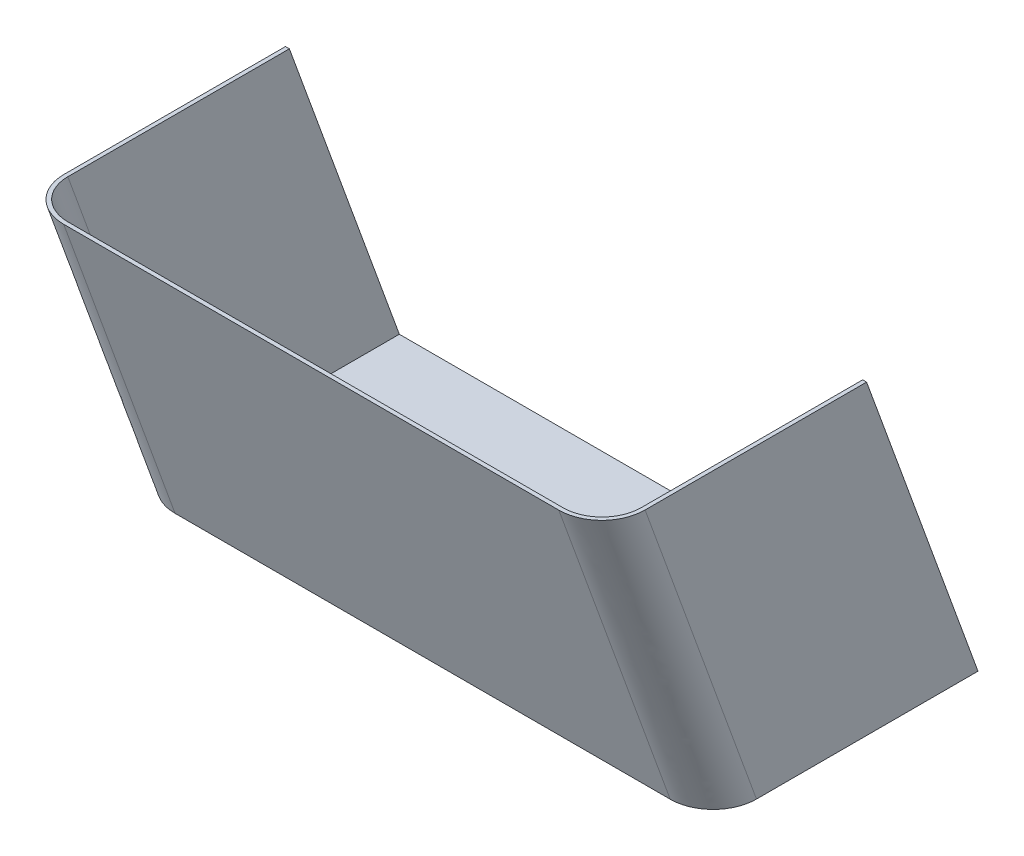
from build123d import *

# Parameters (mm, degrees)
SWEEP_THIN1_START       = 35.293924935
SWEEP_THIN1_DEPTH       = 179.41214993
SWEEP_THIN1_START_2     = -35.293925135
SWEEP_THIN1_2_DEPTH     = 320.587850271
SWEEP_THIN1_START_3     = -67
SWEEP_THIN1_3_OUTLINE_W = 446
SWEEP_THIN1_3_OUTLINE_H = 295
SWEEP_THIN1_3_DEPTH     = 67
SWEEP_THIN1_START_4     = 234.923155196
SWEEP_THIN1_4_OUTLINE_W = 446
SWEEP_THIN1_4_OUTLINE_H = 295
SWEEP_THIN1_4_DEPTH     = 66.330881924
BOSS_EXTRUDE2_DEPTH     = 3
SKETCH6_W               = 723.00386444
SKETCH6_H               = 605.053805232
CUT_EXTRUDE1_DEPTH      = 3


with BuildPart() as part:
    # Sweep-Thin1: read off the stored shape, not the designer's step
    # Sweep-Thin1 outline → Sweep-Thin1 (new body)
    with BuildSketch(Plane(origin=(0, 0, 0), x_dir=(1, 0, 0), z_dir=(0, 0.9396926207859089, 0.3420201433256672)).offset(SWEEP_THIN1_START)):
        with BuildLine():
            Line((223, -65.778483455), (223, 96.969262079))
            Line((223, 96.969262079), (-223, 96.969262079))
            Line((-223, 96.969262079), (-223, -65.778483455))
            add(Edge.make_bspline(
                [(-223, -65.778483455), (-223, -69.477042237), (-222.493972968, -73.37256542), (-221.393047263, -77.378729206), (-219.625765413, -81.371277703), (-217.160966169, -85.187590547), (-214.030117008, -88.644891061), (-210.35485162, -91.564481232), (-206.328004584, -93.851338413), (-202.135894004, -95.485342048), (-197.941508955, -96.501990369), (-193.867765418, -96.969262079), (-190, -96.969262079)],
                knots=[0, 0, 0, 0, 0, 0, 0, 0, 0, 0, 0, 0, 0, 1, 1, 1, 1, 1, 1, 1, 1, 1, 1, 1, 1, 1], degree=12))
            Line((-190, -96.969262079), (190, -96.969262079))
            add(Edge.make_bspline(
                [(190, -96.969262079), (193.867765418, -96.969262079), (197.941508955, -96.501990369), (202.135894005, -95.485342048), (206.328004584, -93.851338413), (210.35485162, -91.564481232), (214.030117008, -88.644891061), (217.16096617, -85.187590547), (219.625765413, -81.371277703), (221.393047263, -77.378729206), (222.493972968, -73.37256542), (223, -69.477042237), (223, -65.778483455)],
                knots=[0, 0, 0, 0, 0, 0, 0, 0, 0, 0, 0, 0, 0, 1, 1, 1, 1, 1, 1, 1, 1, 1, 1, 1, 1, 1], degree=12))
        make_face()
        with BuildLine():
            Line((-220, 93.969262079), (220, 93.969262079))
            Line((220, 93.969262079), (220, -65.778483455))
            add(Edge.make_bspline(
                [(190, -93.969262079), (207.573593129, -93.969262079), (220, -82.292259239), (220, -65.778483455)],
                knots=[0, 0, 0, 0, 1, 1, 1, 1], degree=3, weights=[1, 0.804737854, 0.804737854, 1]))
            Line((190, -93.969262079), (-190, -93.969262079))
            add(Edge.make_bspline(
                [(-220, -65.778483455), (-220, -82.292259239), (-207.573593129, -93.969262079), (-190, -93.969262079)],
                knots=[0, 0, 0, 0, 1, 1, 1, 1], degree=3, weights=[1, 0.804737854, 0.804737854, 1]))
            Line((-220, -65.778483455), (-220, 93.969262079))
        make_face(mode=Mode.SUBTRACT)
    extrude(amount=SWEEP_THIN1_DEPTH)

    # Sweep-Thin1 2 outline → Sweep-Thin1 2 (add)
    with BuildSketch(Plane(origin=(0, 0, 0), x_dir=(1, 0, 0), z_dir=(0, 0.9396926207859089, 0.3420201433256672)).offset(SWEEP_THIN1_START_2)):
        with BuildLine():
            Line((-223, 96.969262079), (-223, -65.778483455))
            add(Edge.make_bspline(
                [(-223, -65.778483455), (-223, -69.477042237), (-222.493972968, -73.37256542), (-221.393047263, -77.378729206), (-219.625765413, -81.371277703), (-217.160966169, -85.187590547), (-214.030117008, -88.644891061), (-210.35485162, -91.564481232), (-206.328004584, -93.851338413), (-202.135894004, -95.485342048), (-197.941508955, -96.501990369), (-193.867765418, -96.969262079), (-190, -96.969262079)],
                knots=[0, 0, 0, 0, 0, 0, 0, 0, 0, 0, 0, 0, 0, 1, 1, 1, 1, 1, 1, 1, 1, 1, 1, 1, 1, 1], degree=12))
            Line((-190, -96.969262079), (190, -96.969262079))
            add(Edge.make_bspline(
                [(190, -96.969262079), (193.867765418, -96.969262079), (197.941508955, -96.501990369), (202.135894005, -95.485342048), (206.328004584, -93.851338413), (210.35485162, -91.564481232), (214.030117008, -88.644891061), (217.16096617, -85.187590547), (219.625765413, -81.371277703), (221.393047263, -77.378729206), (222.493972968, -73.37256542), (223, -69.477042237), (223, -65.778483455)],
                knots=[0, 0, 0, 0, 0, 0, 0, 0, 0, 0, 0, 0, 0, 1, 1, 1, 1, 1, 1, 1, 1, 1, 1, 1, 1, 1], degree=12))
            Line((223, -65.778483455), (223, 96.969262079))
            Line((223, 96.969262079), (-223, 96.969262079))
        make_face()
        with BuildLine():
            add(Edge.make_bspline(
                [(-220, -65.778483455), (-220, -82.292259239), (-207.573593129, -93.969262079), (-190, -93.969262079)],
                knots=[0, 0, 0, 0, 1, 1, 1, 1], degree=3, weights=[1, 0.804737854, 0.804737854, 1]))
            Line((-220, -65.778483455), (-220, 93.969262079))
            Line((-220, 93.969262079), (220, 93.969262079))
            Line((220, 93.969262079), (220, -65.778483455))
            add(Edge.make_bspline(
                [(190, -93.969262079), (207.573593129, -93.969262079), (220, -82.292259239), (220, -65.778483455)],
                knots=[0, 0, 0, 0, 1, 1, 1, 1], degree=3, weights=[1, 0.804737854, 0.804737854, 1]))
            Line((190, -93.969262079), (-190, -93.969262079))
        make_face(mode=Mode.SUBTRACT)
    extrude(amount=SWEEP_THIN1_2_DEPTH)

    # Sweep-Thin1 3 outline → Sweep-Thin1 3 (cut)
    with BuildSketch(Plane(origin=(0, 0, 0), x_dir=(1, 0, 0), z_dir=(0, 1, 0)).offset(SWEEP_THIN1_START_3)):
        with Locations((0, -42.5)):
            Rectangle(SWEEP_THIN1_3_OUTLINE_W, SWEEP_THIN1_3_OUTLINE_H)
    extrude(amount=SWEEP_THIN1_3_DEPTH, mode=Mode.SUBTRACT)

    # Sweep-Thin1 4 outline → Sweep-Thin1 4 (cut)
    with BuildSketch(Plane(origin=(0, 0, 0), x_dir=(1, 0, 0), z_dir=(0, 1, 0)).offset(SWEEP_THIN1_START_4)):
        with Locations((0, -42.5)):
            Rectangle(SWEEP_THIN1_4_OUTLINE_W, SWEEP_THIN1_4_OUTLINE_H)
    extrude(amount=SWEEP_THIN1_4_DEPTH, mode=Mode.SUBTRACT)


with BuildPart() as body_2:
    # Sketch5 → Boss-Extrude2 (new body)
    with BuildSketch(Plane(origin=(0, 0, 0), x_dir=(1, 0, 0), z_dir=(0, 1, 0))):
        with BuildLine():
            Line((-190, -100), (190, -100))
            ThreePointArc((190, -100), (211.213203436, -91.213203436), (220, -70))
            Line((220, -70), (220, 100))
            Line((220, 100), (-220, 100))
            Line((-220, 100), (-220, -70))
            ThreePointArc((-220, -70), (-211.213203436, -91.213203436), (-190, -100))
        make_face()
    extrude(amount=BOSS_EXTRUDE2_DEPTH)


with BuildPart() as cut_extrude1_tool:
    # Sketch6 → Cut-Extrude1 (new body)
    with BuildSketch(Plane(origin=(0, 33.165440914, -91.121300018), x_dir=(-1, 0, 0), z_dir=(0, 0.34202014332566627, -0.9396926207859093))):
        Rectangle(SKETCH6_W, SKETCH6_H)
    extrude(amount=-CUT_EXTRUDE1_DEPTH)


with BuildPart() as part_1:
    add(part.part)

    # Cut-Extrude1: cut by cut_extrude1_tool
    add(cut_extrude1_tool.part, mode=Mode.SUBTRACT)


with BuildPart() as body_2_1:
    add(body_2.part)

    # Cut-Extrude1: cut by cut_extrude1_tool
    add(cut_extrude1_tool.part, mode=Mode.SUBTRACT)


solid = Compound([part_1.part, body_2_1.part])
